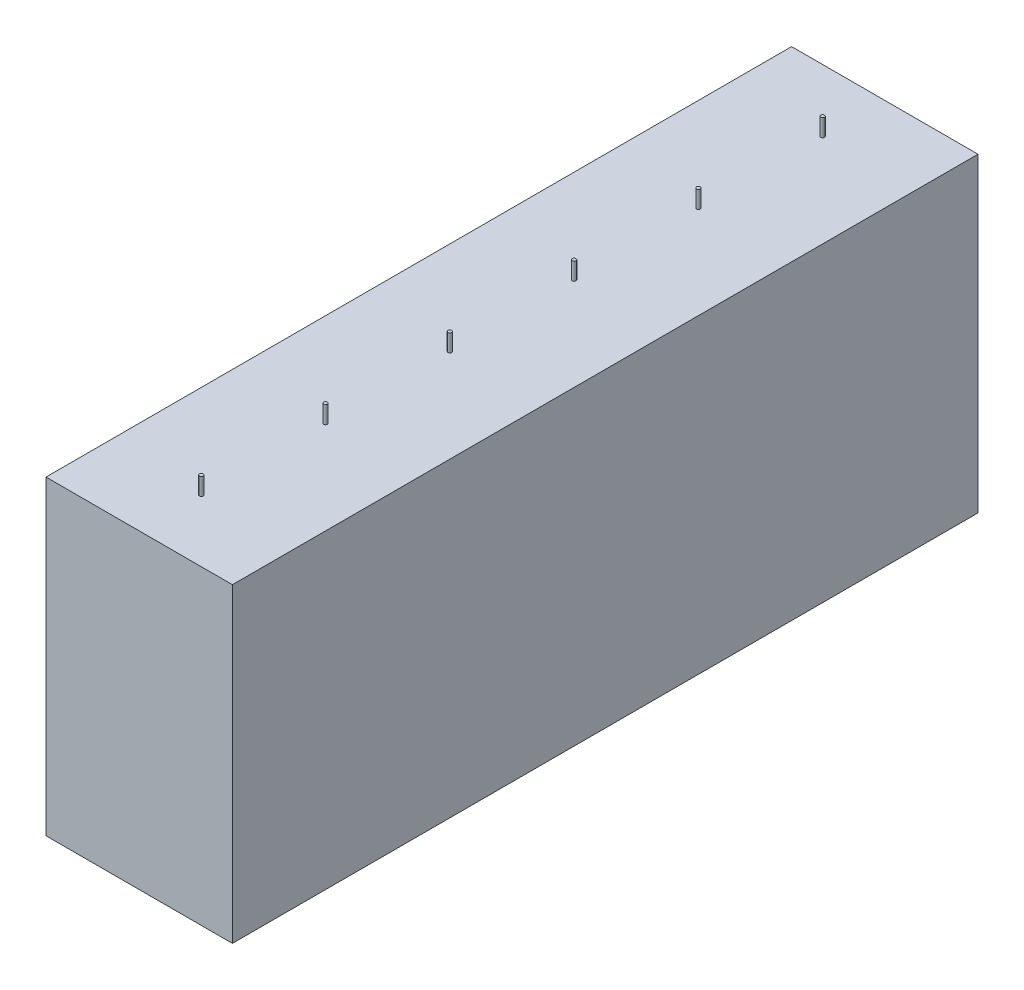
from build123d import *

# Parameters (mm, degrees)
SKETCH_1_W      = 300
SKETCH_1_H      = 1200
EXTRUDE_1_DEPTH = 500
SKETCH_2_R      = 3
EXTRUDE_2_DEPTH = 28


with BuildPart() as part:
    # 草图1 → 凸台-拉伸1 (new body)
    with BuildSketch(Plane(origin=(0, 0, 0), x_dir=(1, 0, 0), z_dir=(0, 1, 0))):
        Rectangle(SKETCH_1_W, SKETCH_1_H)
    extrude(amount=EXTRUDE_1_DEPTH)

    # 草图2 → 凸台-拉伸2 (add)
    with BuildSketch(Plane(origin=(0, 500, 0), x_dir=(1, 0, 0), z_dir=(0, 1, 0))):
        with Locations((0, 500)):
            Circle(SKETCH_2_R)
        with Locations((0, 300)):
            Circle(SKETCH_2_R)
        with Locations((0, 100)):
            Circle(SKETCH_2_R)
        with Locations((0, -100)):
            Circle(SKETCH_2_R)
        with Locations((0, -300)):
            Circle(SKETCH_2_R)
        with Locations((0, -500)):
            Circle(SKETCH_2_R)
    extrude(amount=EXTRUDE_2_DEPTH)


solid = part.part
